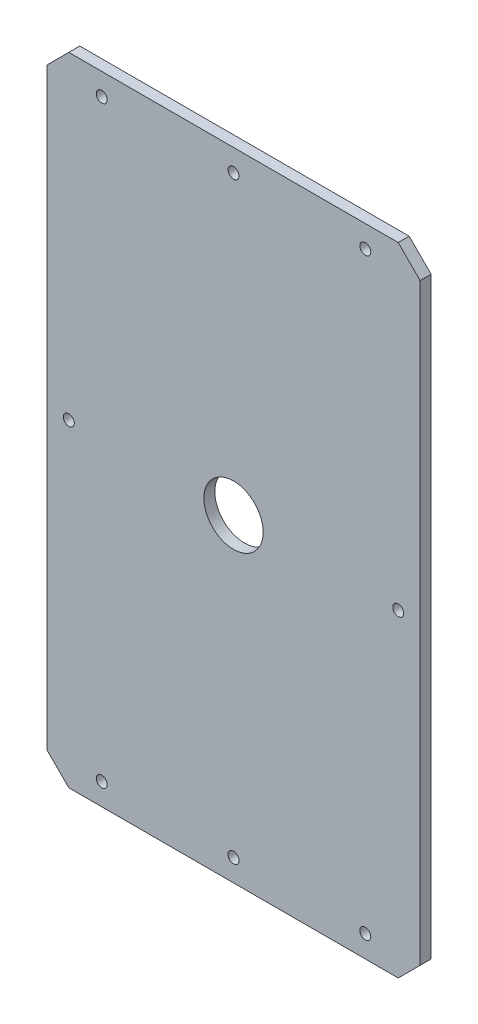
from build123d import *

# Parameters (mm, degrees)
SKETCH_1_W          = 170
SKETCH_1_H          = 290
EXTRUDE_1_DEPTH     = 5
SKETCH_2_R          = 13.5
CUT_EXTRUDE_1_DEPTH = 169.151717208
SKETCH_3_R          = 2.5
CUT_EXTRUDE_2_DEPTH = 169.151717208
CHAMFER_1_SIZE      = 10


with BuildPart() as part:
    # ｽｹｯﾁ1 → ﾎﾞｽ - 押し出し1 (new body)
    with BuildSketch(Plane.XY):
        Rectangle(SKETCH_1_W, SKETCH_1_H)
    extrude(amount=EXTRUDE_1_DEPTH)

    # ｽｹｯﾁ2 → ｶｯﾄ - 押し出し1 (cut, through all)
    with BuildSketch(Plane.XY.offset(5)):
        Circle(SKETCH_2_R)
    extrude(amount=-CUT_EXTRUDE_1_DEPTH, mode=Mode.SUBTRACT)

    # ｽｹｯﾁ3 → ｶｯﾄ - 押し出し2 (cut, through all)
    with BuildSketch(Plane.XY.offset(5)):
        with Locations((-75, 0)):
            Circle(SKETCH_3_R)
        with Locations((0, 135)):
            Circle(SKETCH_3_R)
        with Locations((75, 0)):
            Circle(SKETCH_3_R)
        with Locations((0, -135)):
            Circle(SKETCH_3_R)
        with Locations((-60, 135)):
            Circle(SKETCH_3_R)
        with Locations((60, 135)):
            Circle(SKETCH_3_R)
        with Locations((60, -135)):
            Circle(SKETCH_3_R)
        with Locations((-60, -135)):
            Circle(SKETCH_3_R)
    extrude(amount=-CUT_EXTRUDE_2_DEPTH, mode=Mode.SUBTRACT)

    # 面取り1
    chamfer_1_edges = [part.edges().sort_by_distance(p)[0] for p in [
        (85, -145, 2.5),
        (-85, -145, 2.5),
        (-85, 145, 2.5),
        (85, 145, 2.5),
    ]]
    chamfer(chamfer_1_edges, length=CHAMFER_1_SIZE)


solid = part.part
